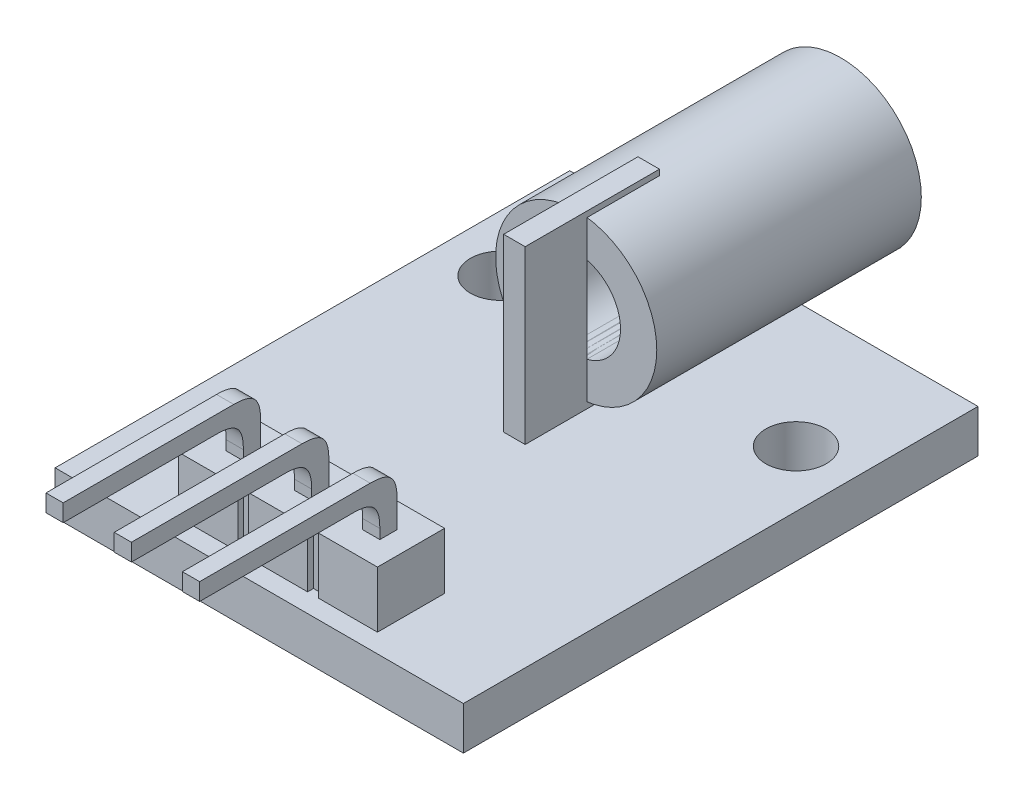
from build123d import *

# Parameters (mm, degrees)
SKETCH1_W                     = 15.2
SKETCH1_H                     = 19.16
BOSS_EXTRUDE1_DEPTH           = 1.6
SKETCH2_R                     = 1.125
CUT_EXTRUDE1_DEPTH            = 13.332736923
BOSS_EXTRUDE2_DEPTH           = 2.1
BOSS_EXTRUDE3_DEPTH           = 0.32
FILLET1_SIZE                  = 1
LPATTERN1_COUNT               = 2
LPATTERN1_PITCH               = 2.54
FILLET1_OF_LPATTERN1_SIZE     = 1
LPATTERN1_COL_COUNT           = 2
LPATTERN1_COL_PITCH           = 2.54
FILLET1_OF_LPATTERN1_COL_SIZE = 1
SKETCH5_W                     = 0.8
SKETCH5_H                     = 5
BOSS_EXTRUDE4_DEPTH           = 6.38
SKETCH6_R                     = 3
BOSS_EXTRUDE7_DEPTH           = 9.85
SKETCH8_R                     = 1.65
CUT_EXTRUDE2_DEPTH            = 9.85
SKETCH9_W                     = 0.64
SKETCH9_H                     = 0.64
BOSS_EXTRUDE11_DEPTH          = 1.38


with BuildPart() as part:
    # Sketch1 → Boss-Extrude1 (new body)
    with BuildSketch(Plane(origin=(0, 0, 0), x_dir=(1, 0, 0), z_dir=(0, 1, 0))):
        Rectangle(SKETCH1_W, SKETCH1_H)
    extrude(amount=-BOSS_EXTRUDE1_DEPTH)

    # Sketch2 → Cut-Extrude1 (cut, through all)
    with BuildSketch(Plane(origin=(0, 0, 0), x_dir=(1, 0, 0), z_dir=(0, 1, 0))):
        with Locations(Location((-5.5, 4.905, 0), (0, 0, 270))):
            Circle(SKETCH2_R)
        with Locations(Location((5.5, 4.905, 0), (0, 0, 270))):
            Circle(SKETCH2_R)
    extrude(amount=-CUT_EXTRUDE1_DEPTH, mode=Mode.SUBTRACT)

    # Sketch3 → Boss-Extrude2 (add)
    with BuildSketch(Plane(origin=(0, 0, 0), x_dir=(1, 0, 0), z_dir=(0, 1, 0))):
        Polygon((-3.7, -6.38), (-1.5, -6.38), (-1.5, -6.598611303), (-1.1, -6.598611303), (-1.1, -6.38), (1.1, -6.38), (1.1, -6.598611303), (1.5, -6.598611303), (1.5, -6.38), (3.7, -6.38), (3.7, -8.88), (1.5, -8.88), (1.5, -8.661388697), (1.1, -8.661388697), (1.1, -8.88), (-1.1, -8.88), (-1.1, -8.661388697), (-1.5, -8.661388697), (-1.5, -8.88), (-3.7, -8.88), align=None)
    extrude(amount=BOSS_EXTRUDE2_DEPTH)

    # Sketch4 → Boss-Extrude3 (add, symmetric)
    with BuildSketch(Plane(origin=(0, 0, 0), x_dir=(0, 0, -1), z_dir=(1, 0, 0))):
        Polygon((-7.95, 2.1), (-7.31, 2.1), (-7.31, 4.1), (-14.66, 4.1), (-14.66, 3.46), (-7.95, 3.46), align=None)
    boss_extrude3 = extrude(amount=BOSS_EXTRUDE3_DEPTH, both=True)

    # Fillet1
    # a fillet whose section is not a circle: 1 mm, written as the material it adds along each edge
    with BuildSketch(Plane(origin=(0.32, 3.46, 7.95), x_dir=(0, -1, 0), z_dir=(-1, 0, 0))) as fillet1_piece_1:
        with BuildLine():
            Bezier((FILLET1_SIZE, 0), (0, 0), (0, FILLET1_SIZE), weights=[1, 1.222222222, 1])
            Line((0, FILLET1_SIZE), (0, 0))
            Line((0, 0), (FILLET1_SIZE, 0))
        make_face()
    extrude(amount=0.64)
    # a fillet whose section is not a circle: 1 mm, written as the material it takes off along each edge
    with BuildSketch(Plane(origin=(-2.82, 4.1, 7.31), x_dir=(0, -1, 0), z_dir=(1, 0, 0))) as fillet1_2_piece_1:
        with BuildLine():
            Bezier((FILLET1_SIZE, 0), (0, 0), (0, -FILLET1_SIZE), weights=[1, 1.222222222, 1])
            Line((0, -FILLET1_SIZE), (0, 0))
            Line((0, 0), (FILLET1_SIZE, 0))
        make_face()
    extrude(amount=5.64, mode=Mode.SUBTRACT)

    # LPattern1: Boss-Extrude3 ×2
    with Locations(*[(i * LPATTERN1_PITCH, 0, 0) for i in range(1, LPATTERN1_COUNT)]):
        add(boss_extrude3)

    # Fillet1 of LPattern1
    # a fillet whose section is not a circle: 1 mm, written as the material it adds along each edge
    with BuildSketch(Plane(origin=(2.86, 3.46, 7.95), x_dir=(0, -1, 0), z_dir=(-1, 0, 0))) as fillet1_of_lpattern1_piece_1:
        with BuildLine():
            Bezier((FILLET1_OF_LPATTERN1_SIZE, 0), (0, 0), (0, FILLET1_OF_LPATTERN1_SIZE), weights=[1, 1.222222222, 1])
            Line((0, FILLET1_OF_LPATTERN1_SIZE), (0, 0))
            Line((0, 0), (FILLET1_OF_LPATTERN1_SIZE, 0))
        make_face()
    extrude(amount=0.64)
    with BuildSketch(Plane(origin=(2.86, 3.46, 7.95), x_dir=(0, -1, 0), z_dir=(-1, 0, 0))) as fillet1_of_lpattern1_piece_2_section:
        with BuildLine():
            Bezier((FILLET1_OF_LPATTERN1_SIZE, 0), (0, 0), (0, FILLET1_OF_LPATTERN1_SIZE), weights=[1, 1.222222222, 1])
            Line((0, FILLET1_OF_LPATTERN1_SIZE), (0, 0))
            Line((0, 0), (FILLET1_OF_LPATTERN1_SIZE, 0))
        make_face()
    fillet1_of_lpattern1_piece_2 = extrude(amount=3.14, mode=Mode.PRIVATE)
    fillet1_of_lpattern1_piece_2 = split(fillet1_of_lpattern1_piece_2, bisect_by=Plane(origin=(0.32, 3.46, 7.95), z_dir=(-1, 0, 0)), keep=Keep.TOP, mode=Mode.PRIVATE)
    add(fillet1_of_lpattern1_piece_2)
    # a fillet whose section is not a circle: 1 mm, written as the material it takes off along each edge
    with BuildSketch(Plane(origin=(-0.28, 4.1, 7.31), x_dir=(0, -1, 0), z_dir=(1, 0, 0))) as fillet1_of_lpattern1_2_piece_1:
        with BuildLine():
            Bezier((FILLET1_OF_LPATTERN1_SIZE, 0), (0, 0), (0, -FILLET1_OF_LPATTERN1_SIZE), weights=[1, 1.222222222, 1])
            Line((0, -FILLET1_OF_LPATTERN1_SIZE), (0, 0))
            Line((0, 0), (FILLET1_OF_LPATTERN1_SIZE, 0))
        make_face()
    extrude(amount=5.64, mode=Mode.SUBTRACT)

    # LPattern1 col: Boss-Extrude3 ×2
    with Locations(*[(-i * LPATTERN1_COL_PITCH, 0, 0) for i in range(1, LPATTERN1_COL_COUNT)]):
        add(boss_extrude3)

    # Fillet1 of LPattern1 col
    # a fillet whose section is not a circle: 1 mm, written as the material it adds along each edge
    with BuildSketch(Plane(origin=(0.28, 3.46, 7.95), x_dir=(0, -1, 0), z_dir=(-1, 0, 0))) as fillet1_of_lpattern1_col_piece_1_section:
        with BuildLine():
            Bezier((FILLET1_OF_LPATTERN1_COL_SIZE, 0), (0, 0), (0, FILLET1_OF_LPATTERN1_COL_SIZE), weights=[1, 1.222222222, 1])
            Line((0, FILLET1_OF_LPATTERN1_COL_SIZE), (0, 0))
            Line((0, 0), (FILLET1_OF_LPATTERN1_COL_SIZE, 0))
        make_face()
    fillet1_of_lpattern1_col_piece_1 = extrude(amount=3.14, mode=Mode.PRIVATE)
    fillet1_of_lpattern1_col_piece_1 = split(fillet1_of_lpattern1_col_piece_1, bisect_by=Plane(origin=(-0.32, 3.46, 7.95), z_dir=(1, 0, 0)), keep=Keep.TOP, mode=Mode.PRIVATE)
    add(fillet1_of_lpattern1_col_piece_1)
    with BuildSketch(Plane(origin=(-2.22, 3.46, 7.95), x_dir=(0, -1, 0), z_dir=(-1, 0, 0))) as fillet1_of_lpattern1_col_piece_2:
        with BuildLine():
            Bezier((FILLET1_OF_LPATTERN1_COL_SIZE, 0), (0, 0), (0, FILLET1_OF_LPATTERN1_COL_SIZE), weights=[1, 1.222222222, 1])
            Line((0, FILLET1_OF_LPATTERN1_COL_SIZE), (0, 0))
            Line((0, 0), (FILLET1_OF_LPATTERN1_COL_SIZE, 0))
        make_face()
    extrude(amount=0.64)
    # a fillet whose section is not a circle: 1 mm, written as the material it takes off along each edge
    with BuildSketch(Plane(origin=(-5.36, 4.1, 7.31), x_dir=(0, -1, 0), z_dir=(1, 0, 0))) as fillet1_of_lpattern1_col_2_piece_1:
        with BuildLine():
            Bezier((FILLET1_OF_LPATTERN1_COL_SIZE, 0), (0, 0), (0, -FILLET1_OF_LPATTERN1_COL_SIZE), weights=[1, 1.222222222, 1])
            Line((0, -FILLET1_OF_LPATTERN1_COL_SIZE), (0, 0))
            Line((0, 0), (FILLET1_OF_LPATTERN1_COL_SIZE, 0))
        make_face()
    extrude(amount=5.64, mode=Mode.SUBTRACT)

    # Sketch5 → Boss-Extrude4 (add)
    with BuildSketch(Plane(origin=(0, 0, 0), x_dir=(1, 0, 0), z_dir=(0, 1, 0))):
        with Locations((0, 2.42)):
            Rectangle(SKETCH5_W, SKETCH5_H)
    extrude(amount=BOSS_EXTRUDE4_DEPTH)


with BuildPart() as body_2:
    # Sketch6 → Boss-Extrude7 (new body)
    with BuildSketch(Plane.XY.offset(-2.22)):
        with Locations((0, 3.2)):
            Circle(SKETCH6_R)
    extrude(amount=-BOSS_EXTRUDE7_DEPTH)


with BuildPart() as cut_extrude2_tool:
    # Sketch8 → Cut-Extrude2 (new body)
    with BuildSketch(Plane(origin=(0, 0, -12.07), x_dir=(-1, 0, 0), z_dir=(0, 0, -1))):
        with Locations((0, 3.2)):
            Circle(SKETCH8_R)
    extrude(amount=-CUT_EXTRUDE2_DEPTH)


with BuildPart() as part_1:
    add(part.part)

    # Cut-Extrude2: cut by cut_extrude2_tool
    add(cut_extrude2_tool.part, mode=Mode.SUBTRACT)

    # Sketch9 → Boss-Extrude11 (add)
    with BuildSketch(Plane.XZ.offset(1.6)):
        with Locations((2.54, 7.63)):
            Rectangle(SKETCH9_W, SKETCH9_H)
        with Locations((0, 7.63)):
            Rectangle(SKETCH9_W, SKETCH9_H)
        with Locations((-2.54, 7.63)):
            Rectangle(SKETCH9_W, SKETCH9_H)
    extrude(amount=BOSS_EXTRUDE11_DEPTH)


with BuildPart() as body_2_1:
    add(body_2.part)

    # Cut-Extrude2: cut by cut_extrude2_tool
    add(cut_extrude2_tool.part, mode=Mode.SUBTRACT)


solid = Compound([part_1.part, body_2_1.part])
